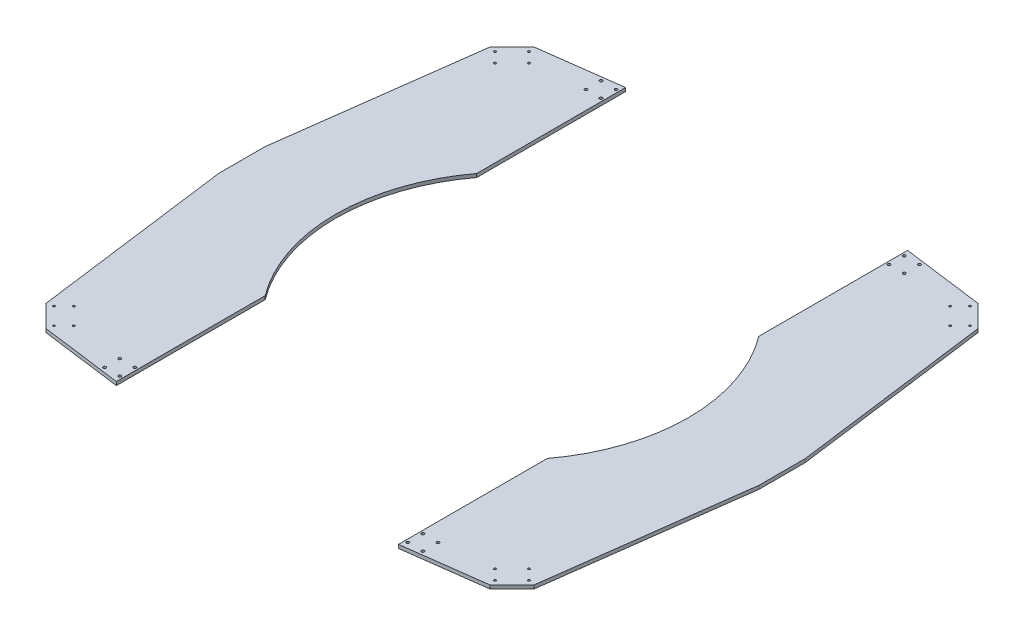
from build123d import *

# Parameters (mm, degrees)
SKETCH_1_R               = 1.5
SKETCH_1_R_2             = 250
EXTRUDE_2_DEPTH          = 5
CUT_EXTRUDE_1_DEPTH      = 542.772616537
CUT_EXTRUDE_1_DEPTH_BACK = 122
CUT_EXTRUDE_2_DEPTH      = 527.431195245
CUT_EXTRUDE_2_DEPTH_BACK = 39
SKETCH_3_R               = 2
CUT_EXTRUDE_3_DEPTH      = 20
CUT_EXTRUDE_3_DEPTH_BACK = 527.431195245
SKETCH_4_R               = 2


with BuildPart() as part:
    # 草图1 → 凸台-拉伸2 (new body)
    with BuildSketch(Plane(origin=(0, 0, 0), x_dir=(1, 0, 0), z_dir=(0, 1, 0))):
        Polygon((-32.720120417, 383.07477601), (-314.9221712, 345.9221712), (-345.9221712, 314.9221712), (-383.07477601, 32.720120417), (-383.07477601, -32.720120417), (-345.9221712, -314.9221712), (-314.9221712, -345.9221712), (-32.720120417, -383.07477601), (32.720120417, -383.07477601), (314.9221712, -345.9221712), (345.9221712, -314.9221712), (383.07477601, -32.720120417), (383.07477601, 32.720120417), (345.9221712, 314.9221712), (314.9221712, 345.9221712), (32.720120417, 383.07477601), (0, 383.07477601), align=None)
        with Locations((-312.744501669, -336.786132229)):
            Circle(SKETCH_1_R, mode=Mode.SUBTRACT)
        with Locations((-336.786132229, -312.744501669)):
            Circle(SKETCH_1_R, mode=Mode.SUBTRACT)
        with Locations((-298.602366045, -322.643996605)):
            Circle(SKETCH_1_R, mode=Mode.SUBTRACT)
        with Locations((-322.643996605, -298.602366045)):
            Circle(SKETCH_1_R, mode=Mode.SUBTRACT)
        with Locations((312.744501669, -336.786132229)):
            Circle(SKETCH_1_R, mode=Mode.SUBTRACT)
        with Locations((298.602366045, -322.643996605)):
            Circle(SKETCH_1_R, mode=Mode.SUBTRACT)
        with Locations((322.643996605, -298.602366045)):
            Circle(SKETCH_1_R, mode=Mode.SUBTRACT)
        with Locations((336.786132229, -312.744501669)):
            Circle(SKETCH_1_R, mode=Mode.SUBTRACT)
        Circle(SKETCH_1_R_2, mode=Mode.SUBTRACT)
        with Locations((-336.786132229, 312.744501669)):
            Circle(SKETCH_1_R, mode=Mode.SUBTRACT)
        with Locations((-322.643996605, 298.602366045)):
            Circle(SKETCH_1_R, mode=Mode.SUBTRACT)
        with Locations((-298.602366045, 322.643996605)):
            Circle(SKETCH_1_R, mode=Mode.SUBTRACT)
        with Locations((-312.744501669, 336.786132229)):
            Circle(SKETCH_1_R, mode=Mode.SUBTRACT)
        with Locations((322.643996605, 298.602366045)):
            Circle(SKETCH_1_R, mode=Mode.SUBTRACT)
        with Locations((298.602366045, 322.643996605)):
            Circle(SKETCH_1_R, mode=Mode.SUBTRACT)
        with Locations((336.786132229, 312.744501669)):
            Circle(SKETCH_1_R, mode=Mode.SUBTRACT)
        with Locations((312.744501669, 336.786132229)):
            Circle(SKETCH_1_R, mode=Mode.SUBTRACT)
    extrude(amount=EXTRUDE_2_DEPTH)

    # 草图2 → 切除-拉伸1 (cut, two sides: drawn at the far end of the back side and taken through both)
    with BuildSketch(Plane(origin=(0, 5, 0), x_dir=(1, 0, 0), z_dir=(0, 1, 0)).offset(-CUT_EXTRUDE_1_DEPTH_BACK)):
        with BuildLine():
            Line((-200, -150), (-200, -361.051962066))
            Line((-200, -361.051962066), (-32.720120417, -383.07477601))
            Line((-32.720120417, -383.07477601), (32.720120417, -383.07477601))
            Line((32.720120417, -383.07477601), (200, -361.051962066))
            Line((200, -361.051962066), (200, -150))
            ThreePointArc((200, -150), (0, -250), (-200, -150))
        make_face()
        with BuildLine():
            ThreePointArc((-200, 150), (0, 250), (200, 150))
            Line((200, 150), (200, 361.051962066))
            Line((200, 361.051962066), (32.720120417, 383.07477601))
            Line((32.720120417, 383.07477601), (-32.720120417, 383.07477601))
            Line((-32.720120417, 383.07477601), (-200, 361.051962066))
            Line((-200, 361.051962066), (-200, 150))
        make_face()
    extrude(amount=CUT_EXTRUDE_1_DEPTH + CUT_EXTRUDE_1_DEPTH_BACK, mode=Mode.SUBTRACT)


with BuildPart() as cut_extrude_1_piece_1:
    # of the separate pieces the step leaves, piece 1, a body of its own (cut_extrude_1_pieces)
    add(part.part.solids().sort_by_distance((200, 0, 361.051962066))[0])


with BuildPart() as cut_extrude_1_piece_2:
    # of the separate pieces the step leaves, piece 2, a body of its own (cut_extrude_1_pieces)
    add(part.part.solids().sort_by_distance((-314.9221712, 0, 345.9221712))[0])

    # 草图3 → 切除-拉伸2 (cut, two sides: drawn at the far end of the back side and taken through both)
    with BuildSketch(Plane(origin=(0, 0, 0), x_dir=(-1, 0, 0), z_dir=(0, -1, 0)).offset(-CUT_EXTRUDE_2_DEPTH_BACK)):
        with Locations((225.752728605, -352.022492419)):
            Circle(SKETCH_3_R)
        with Locations((204.247271395, -352.022492419)):
            Circle(SKETCH_3_R)
        with Locations((225.752728605, -330.51703521)):
            Circle(SKETCH_3_R)
        with Locations((204.247271395, -330.51703521)):
            Circle(SKETCH_3_R)
    extrude(amount=CUT_EXTRUDE_2_DEPTH + CUT_EXTRUDE_2_DEPTH_BACK, mode=Mode.SUBTRACT)


with BuildPart() as cut_extrude_3_tool:
    # 草图4 → 切除-拉伸3 (new, two sides: drawn at the far end of the back side and taken through both)
    with BuildSketch(Plane(origin=(0, 5, 0), x_dir=(1, 0, 0), z_dir=(0, 1, 0)).offset(-CUT_EXTRUDE_3_DEPTH_BACK)):
        with Locations((-204.247271395, 352.018568286)):
            Circle(SKETCH_4_R)
        with Locations((-225.752728605, 352.018568286)):
            Circle(SKETCH_4_R)
        with Locations((-225.752728605, 330.513111077)):
            Circle(SKETCH_4_R)
        with Locations((-204.247271395, 330.513111077)):
            Circle(SKETCH_4_R)
        with Locations((204.247271395, 330.513111077)):
            Circle(SKETCH_4_R)
        with Locations((225.752728605, 330.513111077)):
            Circle(SKETCH_4_R)
        with Locations((204.247271395, 352.018568286)):
            Circle(SKETCH_4_R)
        with Locations((225.752728605, 352.018568286)):
            Circle(SKETCH_4_R)
        with Locations((204.247271395, -352.022492419)):
            Circle(SKETCH_4_R)
        with Locations((225.752728605, -352.022492419)):
            Circle(SKETCH_4_R)
        with Locations((204.247271395, -330.51703521)):
            Circle(SKETCH_4_R)
        with Locations((225.752728605, -330.51703521)):
            Circle(SKETCH_4_R)
    extrude(amount=CUT_EXTRUDE_3_DEPTH + CUT_EXTRUDE_3_DEPTH_BACK)


with BuildPart() as cut_extrude_1_piece_1_1:
    add(cut_extrude_1_piece_1.part)

    # 切除-拉伸3: cut by cut_extrude_3_tool
    add(cut_extrude_3_tool.part, mode=Mode.SUBTRACT)


with BuildPart() as cut_extrude_1_piece_2_1:
    add(cut_extrude_1_piece_2.part)

    # 切除-拉伸3: cut by cut_extrude_3_tool
    add(cut_extrude_3_tool.part, mode=Mode.SUBTRACT)


solid = Compound([cut_extrude_1_piece_1_1.part, cut_extrude_1_piece_2_1.part])
